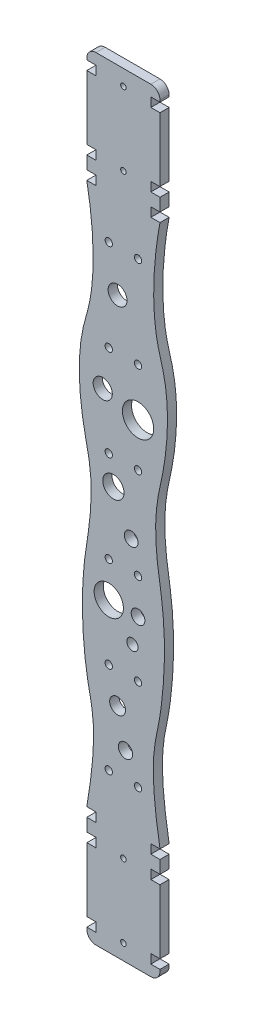
from build123d import *

# Parameters (mm, degrees)
ESQUISSE1_R        = 1.5
ESQUISSE1_R_2      = 2
ESQUISSE1_R_3      = 5.229109031
ESQUISSE1_R_4      = 8.551995964
ESQUISSE1_R_5      = 5.158177567
ESQUISSE1_R_6      = 8
ESQUISSE1_R_7      = 3.072157836
ESQUISSE1_R_8      = 3.743275554
ESQUISSE1_R_9      = 4.322126927
ESQUISSE1_R_10     = 3.914500571
ESQUISSE1_R_11     = 5.819859564
BOSS_EXTRU_1_DEPTH = 5
CONG_1_R           = 5


with BuildPart() as part:
    # Esquisse1 → Boss.-Extru.1 (new body)
    with BuildSketch(Plane.XY):
        with BuildLine():
            Line((-20, 0), (20, 0))
            Line((20, 0), (20, 6))
            Line((20, 6), (15, 6))
            Line((15, 6), (15, 11))
            Line((15, 11), (20, 11))
            Line((20, 11), (19.933455672, 46))
            Line((19.933455672, 46), (15, 46))
            Line((15, 46), (15, 51))
            Line((15, 51), (20, 51))
            Line((20, 51), (20, 58))
            Line((20, 58), (15, 58))
            Line((15, 58), (15, 63))
            Line((15, 63), (20, 63))
            add(Edge.make_bspline(
                [(20, 359.45), (16.079082377, 338.994180612), (15.061734436, 311.052574653), (26.220981942, 277.41099536), (23.571616688, 249.286480825), (16.894695055, 221.643219809), (17.320311392, 203.573817226), (23.179497877, 169.525790044), (22.715740478, 143.838000901), (18.09702301, 113.34806448), (13.512866268, 101.05247313), (20, 63)],
                knots=[0, 0, 0, 0, 0.154869589, 0.19499378, 0.378325457, 0.421485467, 0.583433866, 0.627024504, 0.813801208, 0.853433467, 1, 1, 1, 1], degree=3))
            Line((20, 359.45), (15, 359.45))
            Line((15, 359.45), (15, 364.45))
            Line((15, 364.45), (20, 364.45))
            Line((20, 364.45), (20, 371.45))
            Line((20, 371.45), (15, 371.45))
            Line((15, 371.45), (15, 376.45))
            Line((15, 376.45), (19.933455672, 376.45))
            Line((19.933455672, 376.45), (20, 411.45))
            Line((20, 411.45), (15, 411.45))
            Line((15, 411.45), (15, 416.45))
            Line((15, 416.45), (20, 416.45))
            Line((20, 416.45), (20, 422.45))
            Line((20, 422.45), (-20, 422.45))
            Line((-20, 422.45), (-20, 416.45))
            Line((-20, 416.45), (-15, 416.45))
            Line((-15, 416.45), (-15, 411.45))
            Line((-15, 411.45), (-20, 411.45))
            Line((-20, 411.45), (-19.933455672, 376.45))
            Line((-19.933455672, 376.45), (-15, 376.45))
            Line((-15, 376.45), (-15, 371.45))
            Line((-15, 371.45), (-20, 371.45))
            Line((-20, 371.45), (-20, 364.45))
            Line((-20, 364.45), (-15, 364.45))
            Line((-15, 364.45), (-15, 359.45))
            Line((-15, 359.45), (-20, 359.45))
            add(Edge.make_bspline(
                [(-20, 359.45), (-16.079082377, 338.994180612), (-15.061734436, 311.052574653), (-26.220981942, 277.41099536), (-23.571616688, 249.286480825), (-16.894695055, 221.643219809), (-17.320311392, 203.573817226), (-23.179497877, 169.525790044), (-22.715740478, 143.838000901), (-18.09702301, 113.34806448), (-13.512866268, 101.05247313), (-20, 63)],
                knots=[0, 0, 0, 0, 0.154869589, 0.19499378, 0.378325457, 0.421485467, 0.583433866, 0.627024504, 0.813801208, 0.853433467, 1, 1, 1, 1], degree=3))
            Line((-20, 63), (-15, 63))
            Line((-15, 63), (-15, 58))
            Line((-15, 58), (-20, 58))
            Line((-20, 58), (-20, 51))
            Line((-20, 51), (-15, 51))
            Line((-15, 51), (-15, 46))
            Line((-15, 46), (-19.933455672, 46))
            Line((-19.933455672, 46), (-20, 11))
            Line((-20, 11), (-15, 11))
            Line((-15, 11), (-15, 6))
            Line((-15, 6), (-20, 6))
            Line((-20, 6), (-20, 0))
        make_face()
        with Locations((0, 48.5)):
            Circle(ESQUISSE1_R, mode=Mode.SUBTRACT)
        with Locations((0, 8.5)):
            Circle(ESQUISSE1_R, mode=Mode.SUBTRACT)
        with Locations((0, 413.95)):
            Circle(ESQUISSE1_R, mode=Mode.SUBTRACT)
        with Locations((0, 373.95)):
            Circle(ESQUISSE1_R, mode=Mode.SUBTRACT)
        with Locations((-8, 336.225)):
            Circle(ESQUISSE1_R_2, mode=Mode.SUBTRACT)
        with Locations((8, 336.225)):
            Circle(ESQUISSE1_R_2, mode=Mode.SUBTRACT)
        with Locations((8, 286.225)):
            Circle(ESQUISSE1_R_2, mode=Mode.SUBTRACT)
        with Locations((-8, 286.225)):
            Circle(ESQUISSE1_R_2, mode=Mode.SUBTRACT)
        with Locations((8, 236.225)):
            Circle(ESQUISSE1_R_2, mode=Mode.SUBTRACT)
        with Locations((-8, 236.225)):
            Circle(ESQUISSE1_R_2, mode=Mode.SUBTRACT)
        with Locations((8, 186.225)):
            Circle(ESQUISSE1_R_2, mode=Mode.SUBTRACT)
        with Locations((-8, 186.225)):
            Circle(ESQUISSE1_R_2, mode=Mode.SUBTRACT)
        with Locations((8, 136.225)):
            Circle(ESQUISSE1_R_2, mode=Mode.SUBTRACT)
        with Locations((-8, 136.225)):
            Circle(ESQUISSE1_R_2, mode=Mode.SUBTRACT)
        with Locations((8, 86.225)):
            Circle(ESQUISSE1_R_2, mode=Mode.SUBTRACT)
        with Locations((-8, 86.225)):
            Circle(ESQUISSE1_R_2, mode=Mode.SUBTRACT)
        with Locations((-11.299380195, 265.282644745)):
            Circle(ESQUISSE1_R_3, mode=Mode.SUBTRACT)
        with Locations((8, 260.053535714)):
            Circle(ESQUISSE1_R_4, mode=Mode.SUBTRACT)
        with Locations((-3.185769016, 313.558631262)):
            Circle(ESQUISSE1_R_5, mode=Mode.SUBTRACT)
        with Locations((-8, 166.864541141)):
            Circle(ESQUISSE1_R_6, mode=Mode.SUBTRACT)
        with Locations((4.927842164, 152.260041018)):
            Circle(ESQUISSE1_R_7, mode=Mode.SUBTRACT)
        with Locations((8, 166.864541141)):
            Circle(ESQUISSE1_R_8, mode=Mode.SUBTRACT)
        with Locations((-3.185769016, 119.156507407)):
            Circle(ESQUISSE1_R_9, mode=Mode.SUBTRACT)
        with Locations((1.136357912, 100.170657248)):
            Circle(ESQUISSE1_R_10, mode=Mode.SUBTRACT)
        with Locations((4.256724446, 201.915341435)):
            Circle(ESQUISSE1_R_8, mode=Mode.SUBTRACT)
        with Locations((-5.471114106, 221.7141193)):
            Circle(ESQUISSE1_R_11, mode=Mode.SUBTRACT)
    extrude(amount=BOSS_EXTRU_1_DEPTH)

    # Congé1
    cong_1_edges = [part.edges().sort_by_distance(p)[0] for p in [
        (20, 0, 2.5),
        (-20, 0, 2.5),
        (-20, 422.45, 2.5),
        (20, 422.45, 2.5),
    ]]
    fillet(cong_1_edges, radius=CONG_1_R)


solid = part.part
